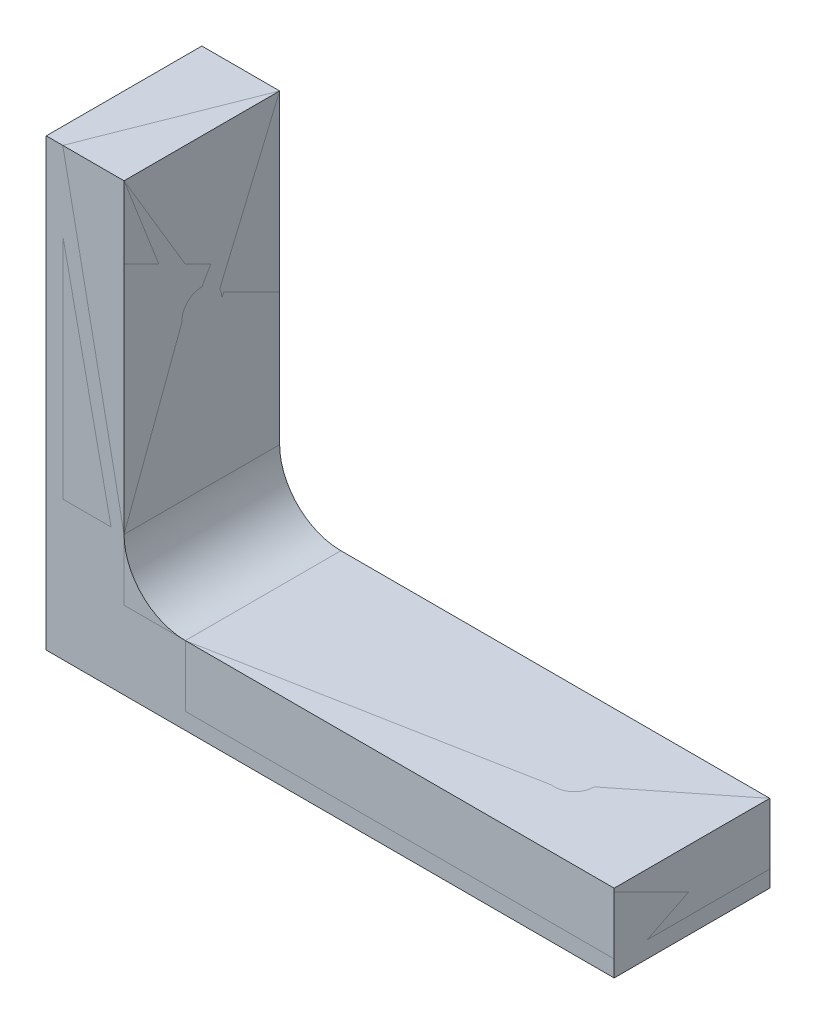
from build123d import *

# Parameters (mm, degrees)
SKETCH1_W               = 6.35
SKETCH1_H               = 30
BOSS_EXTRUDE1_DEPTH     = 12.7
CONVERT_SOLID1_DEPTH    = 12.7
SKETCH6_R               = 1.63195
CUT_EXTRUDE1_DEPTH      = 6.35
CUT_EXTRUDE2_DEPTH      = 61.257240229
CUT_EXTRUDE2_DEPTH_BACK = 61.257240229
SKETCH7_R               = 1.63195


# Read off the part's stored shape, not the designer's step: Convert-Solid1
with BuildPart() as part:
    # Sketch1 → Boss-Extrude1 (new body)
    with BuildSketch(Plane.XY):
        Polygon((46.35, -36.35), (46.35, -30), (6.35, -30), (0, -30), (0, -36.35), align=None)
        with Locations((3.175, -15)):
            Rectangle(SKETCH1_W, SKETCH1_H)
    extrude(amount=BOSS_EXTRUDE1_DEPTH)


with BuildPart() as body_2:
    # Convert-Solid1 outline → Convert-Solid1 (new body)
    with BuildSketch(Plane.XY):
        with BuildLine():
            Line((6.35, 0), (1.35, 0))
            Line((1.35, 0), (1.35, -25))
            ThreePointArc((1.35, -25), (4.278932188, -32.071067812), (11.35, -35))
            Line((11.35, -35), (46.35, -35))
            Line((46.35, -35), (46.35, -30))
            Line((46.35, -30), (11.35, -30))
            ThreePointArc((11.35, -30), (7.814466094, -28.535533906), (6.35, -25))
            Line((6.35, -25), (6.35, 0))
        make_face()
    extrude(amount=CONVERT_SOLID1_DEPTH)

    # Sketch6 → Cut-Extrude1 (cut)
    with BuildSketch(Plane(origin=(0, 0, 0), x_dir=(0, 0, -1), z_dir=(1, 0, 0))):
        with Locations(Location((-6.35, -12.3, 0), (0, 0, 90))):
            Circle(SKETCH6_R)
    extrude(amount=CUT_EXTRUDE1_DEPTH, mode=Mode.SUBTRACT)

    # Sketch7 → Cut-Extrude2 (cut, two sides: drawn at the far end of the back side and taken through both)
    with BuildSketch(Plane(origin=(0, 0, 0), x_dir=(1, 0, 0), z_dir=(0, 1, 0)).offset(-CUT_EXTRUDE2_DEPTH_BACK)):
        with Locations((36.75, -6.35)):
            Circle(SKETCH7_R)
        with Locations((62.15, -6.35)):
            Circle(SKETCH7_R)
    extrude(amount=CUT_EXTRUDE2_DEPTH + CUT_EXTRUDE2_DEPTH_BACK, mode=Mode.SUBTRACT)


solid = Compound([part.part, body_2.part])
